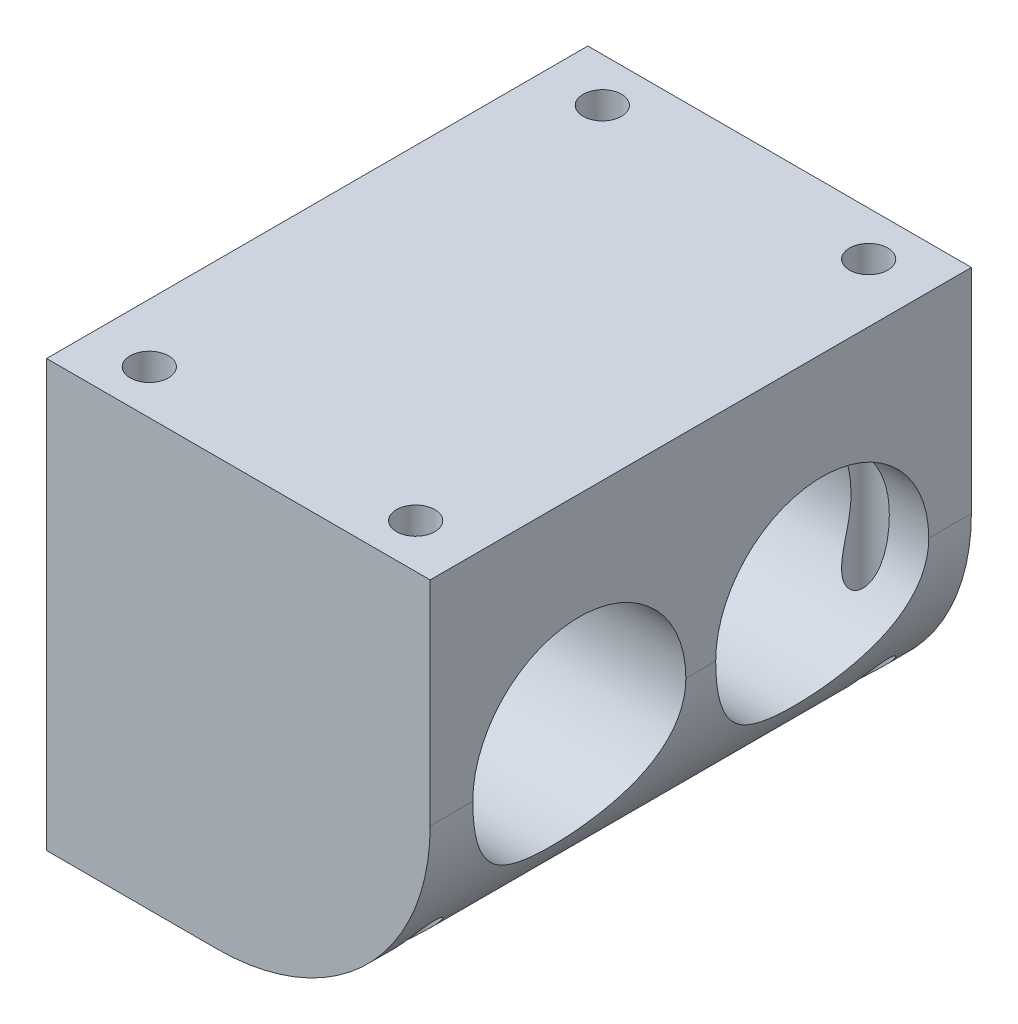
from build123d import *

# Parameters (mm, degrees)
SKETCH1_W                      = 18
SKETCH1_H                      = 25.4
SKETCH1_R                      = 0.9
BOSS_EXTRUDE1_DEPTH            = 20
CBORE_FOR_M5_SHCS1_D           = 5.5
CBORE_FOR_M5_SHCS1_CBORE_D     = 10
CBORE_FOR_M5_SHCS1_CBORE_DEPTH = 12
FILLET1_R                      = 10


with BuildPart() as part:
    # Sketch1 → Boss-Extrude1 (new body)
    with BuildSketch(Plane(origin=(0, 0, 0), x_dir=(1, 0, 0), z_dir=(0, 1, 0))):
        Rectangle(SKETCH1_W, SKETCH1_H)
        with Locations(Location((-6.25, 10.6299, 0), (0, 0, 270))):
            Circle(SKETCH1_R, mode=Mode.SUBTRACT)
        with Locations(Location((6.25, 10.6299, 0), (0, 0, 270))):
            Circle(SKETCH1_R, mode=Mode.SUBTRACT)
        with Locations(Location((6.25, -10.6299, 0), (0, 0, 270))):
            Circle(SKETCH1_R, mode=Mode.SUBTRACT)
        with Locations(Location((-6.25, -10.6299, 0), (0, 0, 270))):
            Circle(SKETCH1_R, mode=Mode.SUBTRACT)
    extrude(amount=BOSS_EXTRUDE1_DEPTH)

    # CBORE for M5 SHCS1 (through all)
    with Locations(Plane(origin=(9, 0, 0), x_dir=(0, 0, -1), z_dir=(1, 0, 0))):
        with Locations((-5.7, 10), (5.7, 10)):
            CounterBoreHole(CBORE_FOR_M5_SHCS1_D / 2, CBORE_FOR_M5_SHCS1_CBORE_D / 2, CBORE_FOR_M5_SHCS1_CBORE_DEPTH)

    # Fillet1
    # the kernel refuses this fillet: 10 mm, written as the material it takes off along each edge
    with BuildSketch(Plane(origin=(9, 0, -37.7), x_dir=(0, 1, 0), z_dir=(0, 0, 1))) as fillet1_piece_1:
        with BuildLine():
            CenterArc((FILLET1_R, FILLET1_R), FILLET1_R, 180, 90)
            Line((0, FILLET1_R), (0, 0))
            Line((0, 0), (FILLET1_R, 0))
        make_face()
    extrude(amount=75.4, mode=Mode.SUBTRACT)


solid = part.part
